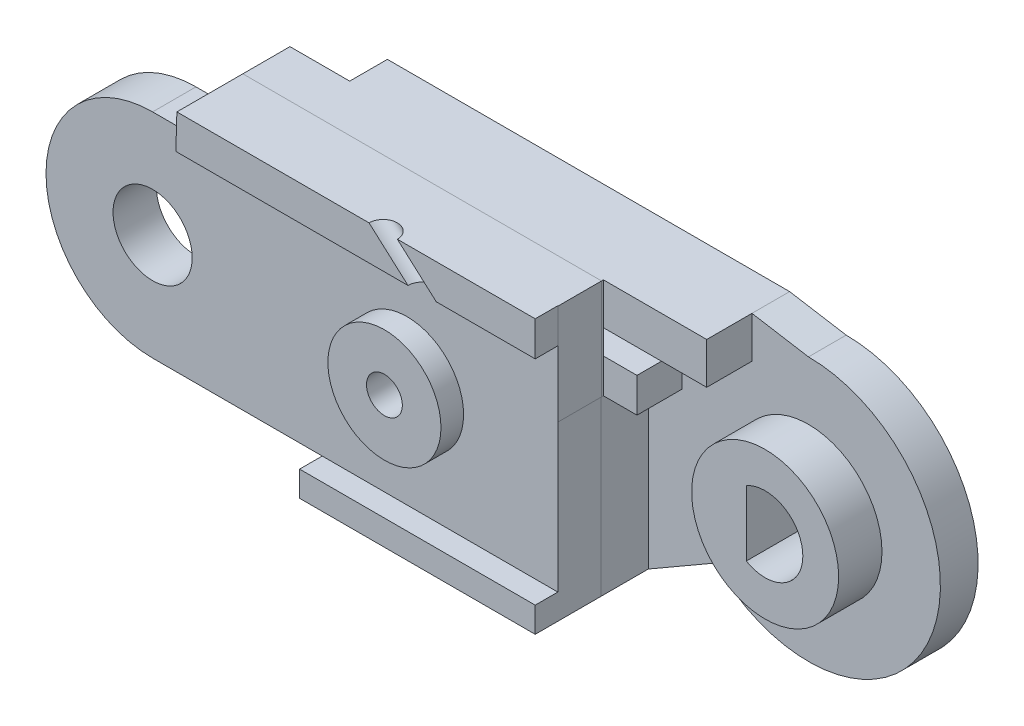
from build123d import *

# Parameters (mm, degrees)
BOSS_EXTRUDE1_DEPTH  = 2
BOSS_EXTRUDE6_DEPTH  = 2.5
CUT_EXTRUDE6_DEPTH   = 2.4
BOSS_EXTRUDE14_DEPTH = 2.3
SKETCH32_R           = 2.1
CUT_EXTRUDE7_DEPTH   = 2.3
SKETCH33_W           = 12.5
SKETCH33_H           = 1.343145751
BOSS_EXTRUDE15_DEPTH = 1.2
SKETCH35_W           = 5.479645997
SKETCH35_H           = 5.327993755
CUT_EXTRUDE8_DEPTH   = 2.4
SKETCH36_W           = 3.7
SKETCH36_H           = 1.827993755
CUT_EXTRUDE9_DEPTH   = 2.4
SKETCH37_R           = 3.9
BOSS_EXTRUDE16_DEPTH = 2.3
CUT_EXTRUDE10_DEPTH  = 38.996578793
SKETCH43_R           = 3
BOSS_EXTRUDE17_DEPTH = 1.2
SKETCH44_R           = 0.95
CUT_EXTRUDE11_DEPTH  = 39.590802013
SKETCH45_R           = 2
CUT_EXTRUDE12_DEPTH  = 3.2
SKETCH47_R           = 0.75
CUT_EXTRUDE13_DEPTH  = 5.2


with BuildPart() as part:
    # Sketch3 → Boss-Extrude1 (new body)
    with BuildSketch(Plane.XY):
        with BuildLine():
            Line((8, 0), (9, -2.5))
            Line((9, -2.5), (9, -7))
            Line((9, -7), (21.5, -7))
            Line((21.5, -7), (25.050252532, -4.949747468))
            ThreePointArc((25.050252532, -4.949747468), (36.467156728, -2.678784027), (30, 7))
            Line((30, 7), (27, 7.5))
            Line((27, 7.5), (5.656854249, 7.5))
            Line((5.656854249, 7.5), (5.656854249, 5.656854249))
            ThreePointArc((5.656854249, 5.656854249), (7.39103626, 3.061467459), (8, 0))
        make_face()
    extrude(amount=BOSS_EXTRUDE1_DEPTH)

    # Sketch22 → Boss-Extrude6 (add)
    with BuildSketch(Plane.XY.offset(2)):
        with BuildLine():
            Line((5.656854249, 5.656854249), (2.486790148, 5.656854249))
            Line((2.486790148, 5.656854249), (2.486790148, 7.5))
            Line((2.486790148, 7.5), (5.656854249, 7.5))
            Line((5.656854249, 7.5), (21.5, 7.5))
            Line((21.5, 7.5), (27, 7.5))
            Line((27, 7.5), (27, 2.172006245))
            Line((27, 2.172006245), (21.5, 2.172006245))
            Line((21.5, 2.172006245), (21.5, 0))
            Line((21.5, 0), (21.5, -7))
            Line((21.5, -7), (9, -7))
            Line((9, -7), (9, -2.5))
            Line((9, -2.5), (8, 0))
            ThreePointArc((8, 0), (7.39103626, 3.061467459), (5.656854249, 5.656854249))
        make_face()
    extrude(amount=BOSS_EXTRUDE6_DEPTH)

    # Sketch26 → Cut-Extrude6 (cut)
    with BuildSketch(Plane.XY.offset(2)):
        Polygon((18.098080448, 5.3), (2.530052458, 5.3), (2.530052458, 4), (18.098080448, 4), (27, 4), (27, 5.3), align=None)
    extrude(amount=CUT_EXTRUDE6_DEPTH, mode=Mode.SUBTRACT)


with BuildPart() as body_2:
    # Sketch31 → Boss-Extrude14 (new body)
    with BuildSketch(Plane.XY.offset(4.5)):
        with BuildLine():
            Line((2.432688066, 5.656854249), (0, 5.656854249))
            ThreePointArc((0, 5.656854249), (-5.656854249, 0), (0, -5.656854249))
            Line((0, -5.656854249), (9, -5.656854249))
            Line((9, -5.656854249), (9, -7))
            Line((9, -7), (21.5, -7))
            Line((21.5, -7), (21.5, 2.172006245))
            Line((21.5, 2.172006245), (27, 2.172006245))
            Line((27, 2.172006245), (27, 7.5))
            Line((27, 7.5), (21.5, 7.5))
            Line((21.5, 7.5), (2.486790148, 7.5))
            Line((2.486790148, 7.5), (2.432688066, 5.656854249))
        make_face()
    extrude(amount=BOSS_EXTRUDE14_DEPTH)

    # Sketch32 → Cut-Extrude7 (cut)
    with BuildSketch(Plane.XY.offset(6.8)):
        Circle(SKETCH32_R)
    extrude(amount=-CUT_EXTRUDE7_DEPTH, mode=Mode.SUBTRACT)

    # Sketch33 → Boss-Extrude15 (add)
    with BuildSketch(Plane.XY.offset(6.8)):
        Polygon((2.486790148, 7.5), (21.5, 7.5), (21.5, 5.656854249), (2.432688066, 5.656854249), align=None)
        with Locations((15.25, -6.328427125)):
            Rectangle(SKETCH33_W, SKETCH33_H)
    extrude(amount=BOSS_EXTRUDE15_DEPTH)


with BuildPart() as cut_extrude8_tool:
    # Sketch35 → Cut-Extrude8 (new body)
    with BuildSketch(Plane.XY.offset(6.8)):
        with Locations((24.260177002, 4.836003123)):
            Rectangle(SKETCH35_W, SKETCH35_H)
    extrude(amount=-CUT_EXTRUDE8_DEPTH)


with BuildPart() as part_1:
    add(part.part)

    # Cut-Extrude8: cut by cut_extrude8_tool
    add(cut_extrude8_tool.part, mode=Mode.SUBTRACT)

    # Sketch36 → Cut-Extrude9 (cut)
    with BuildSketch(Plane.XY.offset(4.4)):
        with Locations((25.15, 3.086003123)):
            Rectangle(SKETCH36_W, SKETCH36_H)
    extrude(amount=-CUT_EXTRUDE9_DEPTH, mode=Mode.SUBTRACT)

    # Sketch37 → Boss-Extrude16 (add)
    with BuildSketch(Plane.XY.offset(2)):
        with Locations((30, 0)):
            Circle(SKETCH37_R)
    extrude(amount=BOSS_EXTRUDE16_DEPTH)

    # Sketch39 → Cut-Extrude10 (cut, through all)
    with BuildSketch(Plane.XY.offset(4.3)):
        with BuildLine():
            Line((29, 1.732050808), (29, -1.732050808))
            ThreePointArc((29, -1.732050808), (32, 0), (29, 1.732050808))
        make_face()
    extrude(amount=-CUT_EXTRUDE10_DEPTH, mode=Mode.SUBTRACT)


with BuildPart() as body_2_1:
    add(body_2.part)

    # Cut-Extrude8: cut by cut_extrude8_tool
    add(cut_extrude8_tool.part, mode=Mode.SUBTRACT)

    # Sketch43 → Boss-Extrude17 (add)
    with BuildSketch(Plane.XY.offset(6.8)):
        with Locations((13.5, 0)):
            Circle(SKETCH43_R)
    extrude(amount=BOSS_EXTRUDE17_DEPTH)


with BuildPart() as cut_extrude11_tool:
    # Sketch44 → Cut-Extrude11 (new, through all)
    with BuildSketch(Plane.XY.offset(8)):
        with Locations((13.5, 0)):
            Circle(SKETCH44_R)
    extrude(amount=-CUT_EXTRUDE11_DEPTH)


with BuildPart() as part_2:
    add(part_1.part)

    # Cut-Extrude11: cut by cut_extrude11_tool
    add(cut_extrude11_tool.part, mode=Mode.SUBTRACT)

    # Sketch45 → Cut-Extrude12 (cut)
    with BuildSketch(Plane(origin=(0, 0, 0), x_dir=(-1, 0, 0), z_dir=(0, 0, -1))):
        with Locations((-13.5, 0)):
            Circle(SKETCH45_R)
    extrude(amount=-CUT_EXTRUDE12_DEPTH, mode=Mode.SUBTRACT)


with BuildPart() as body_2_2:
    add(body_2_1.part)

    # Cut-Extrude11: cut by cut_extrude11_tool
    add(cut_extrude11_tool.part, mode=Mode.SUBTRACT)

    # Sketch47 → Cut-Extrude13 (cut, along a direction that is not the sketch's normal)
    with BuildSketch(Plane.XZ.offset(-5.656854249)):
        with Locations((15.5, 8)):
            Circle(SKETCH47_R)
    extrude(amount=-CUT_EXTRUDE13_DEPTH, dir=(0.7462461216224772, -0.6656701329963746, 0), mode=Mode.SUBTRACT)


solid = Compound([part_2.part, body_2_2.part])
